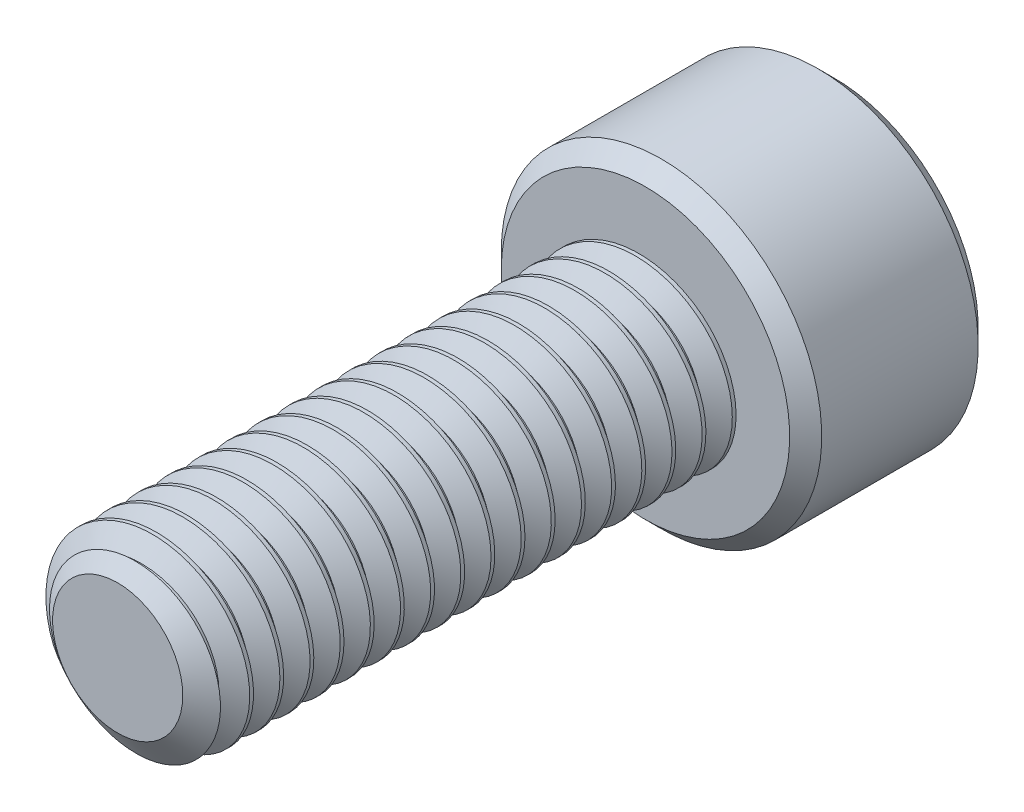
from build123d import *

# Parameters (mm, degrees)
SKETCH1_R          = 2.5
EXTRUDE1_DEPTH     = 14
CUT_SWEEP1_PITCH   = 0.8
SKETCH6_R          = 4.25
EXTRUDE2_DEPTH     = 5
CUT_EXTRUDE1_DEPTH = 3
CHAMFER1_SIZE      = 0.425


with BuildPart() as part:
    # Sketch1 → Extrude1 (new body)
    with BuildSketch(Plane.XY):
        Circle(SKETCH1_R)
    extrude(amount=-EXTRUDE1_DEPTH)

    # Cut-Sweep1: the profile of Sketch3 profile screwed along a right-hand helix of 18.5 turns, 6 arcs to a turn; built about Z, then put on its axis
    cut_sweep1_z = Axis((0, 0, 0), (0, 0, 1))
    cut_sweep1_corners = [(2.5003, 0, -0.700173205), (1.980384758, 0, -0.4), (1.980384758, 0, -0.3), (2.5003, 0, 0.000173205)]
    with BuildLine(mode=Mode.PRIVATE) as cut_sweep1_profile:
        Line(cut_sweep1_corners[0], cut_sweep1_corners[1])
        Line(cut_sweep1_corners[1], cut_sweep1_corners[2])
        Line(cut_sweep1_corners[2], cut_sweep1_corners[3])
        Line(cut_sweep1_corners[3], cut_sweep1_corners[0])
    cut_sweep1_cap = Face(cut_sweep1_profile.wire())
    cut_sweep1_turn_angles = [0, 30, 60, 90, 120, 150, 180, 210, 240, 270, 300, 330, 360]
    cut_sweep1_turn_weights = [1, 0.8660254037844387, 1, 0.8660254037844387, 1, 0.8660254037844387, 1, 0.8660254037844387, 1, 0.8660254037844387, 1, 0.8660254037844387, 1]
    cut_sweep1_turn_rails = [Edge.make_bspline([Vector(p[0], p[1], 0).rotate(cut_sweep1_z, cut_sweep1_turn_angles[k]) / cut_sweep1_turn_weights[k] + Vector(0, 0, p[2] + CUT_SWEEP1_PITCH * cut_sweep1_turn_angles[k] / 360) for k in range(13)], [0, 0, 0, 1, 1, 2, 2, 3, 3, 4, 4, 5, 5, 6, 6, 6], 2, cut_sweep1_turn_weights) for p in cut_sweep1_corners]
    cut_sweep1_turn_sides = [Face.make_surface_from_curves(cut_sweep1_turn_rails[p[0]], cut_sweep1_turn_rails[p[1]]) for p in [(0, 1), (1, 2), (2, 3), (3, 0)]]
    cut_sweep1_last_angles = [6480, 6510, 6540, 6570, 6600, 6630, 6660]
    cut_sweep1_last_weights = [1, 0.8660254037844387, 1, 0.8660254037844387, 1, 0.8660254037843871, 1]
    cut_sweep1_last_rails = [Edge.make_bspline([Vector(p[0], p[1], 0).rotate(cut_sweep1_z, cut_sweep1_last_angles[k]) / cut_sweep1_last_weights[k] + Vector(0, 0, p[2] + CUT_SWEEP1_PITCH * cut_sweep1_last_angles[k] / 360) for k in range(7)], [0, 0, 0, 1, 1, 2, 2, 3, 3, 3], 2, cut_sweep1_last_weights) for p in cut_sweep1_corners]
    cut_sweep1_last_sides = [Face.make_surface_from_curves(cut_sweep1_last_rails[p[0]], cut_sweep1_last_rails[p[1]]) for p in [(0, 1), (1, 2), (2, 3), (3, 0)]]
    cut_sweep1 = Plane(origin=(0, 0, 0), x_dir=(0, 1, 0), z_dir=(0, 0, -1)) * Solid(Shell([*[p.moved(Location((0, 0, CUT_SWEEP1_PITCH * i))) for i in range(18) for p in cut_sweep1_turn_sides], *cut_sweep1_last_sides, cut_sweep1_cap, cut_sweep1_cap.rotate(cut_sweep1_z, 6660).moved(Location((0, 0, CUT_SWEEP1_PITCH * 6660 / 360)))]))
    add(cut_sweep1, mode=Mode.SUBTRACT)

    # Sketch4 → Cut-Revolve1 (revolve, cut)
    with BuildSketch(Plane(origin=(0, 0, 0), x_dir=(0, 0, -1), z_dir=(1, 0, 0)), mode=Mode.PRIVATE) as cut_revolve1_sk:
        Polygon((0.541691224, 2.5), (0, 1.726384758), (0, 2.5), align=None)
    revolve(cut_revolve1_sk.sketch.rotate(Axis((0, 0, 0), (0, 0, -1)), 260.43858876), axis=Axis((0, 0, 0), (0, 0, -1)), mode=Mode.SUBTRACT)

    # Sketch6 → Extrude2 (add)
    with BuildSketch(Plane(origin=(0, 0, -14), x_dir=(-1, 0, 0), z_dir=(0, 0, -1))):
        Circle(SKETCH6_R)
    extrude(amount=EXTRUDE2_DEPTH)

    # Sketch7 → Cut-Extrude1 (cut)
    with BuildSketch(Plane(origin=(0, 0, -19), x_dir=(-1, 0, 0), z_dir=(0, 0, -1))):
        Polygon((0, 2.309401077), (-2, 1.154700538), (-2, -1.154700538), (0, -2.309401077), (2, -1.154700538), (2, 1.154700538), align=None)
    extrude(amount=-CUT_EXTRUDE1_DEPTH, mode=Mode.SUBTRACT)

    # Cut-Extrude2 cone 1 section (through the dimple's axis) → Cut-Extrude2 (revolve, cut)
    with BuildSketch(Plane(origin=(0, 0, -19), x_dir=(0, 1, 0), z_dir=(1, 0, 0))):
        Polygon((0, 0), (2.309401077, 0), (0, 2.309401077), align=None)
    revolve(axis=Axis((0, 0, -19), (0, 0, 1)), mode=Mode.SUBTRACT)

    # Chamfer1
    chamfer1_edges = [part.edges().sort_by_distance(p)[0] for p in [
        (4.25, 0, -14),
        (4.25, 0, -19),
    ]]
    chamfer(chamfer1_edges, length=CHAMFER1_SIZE)


solid = part.part
